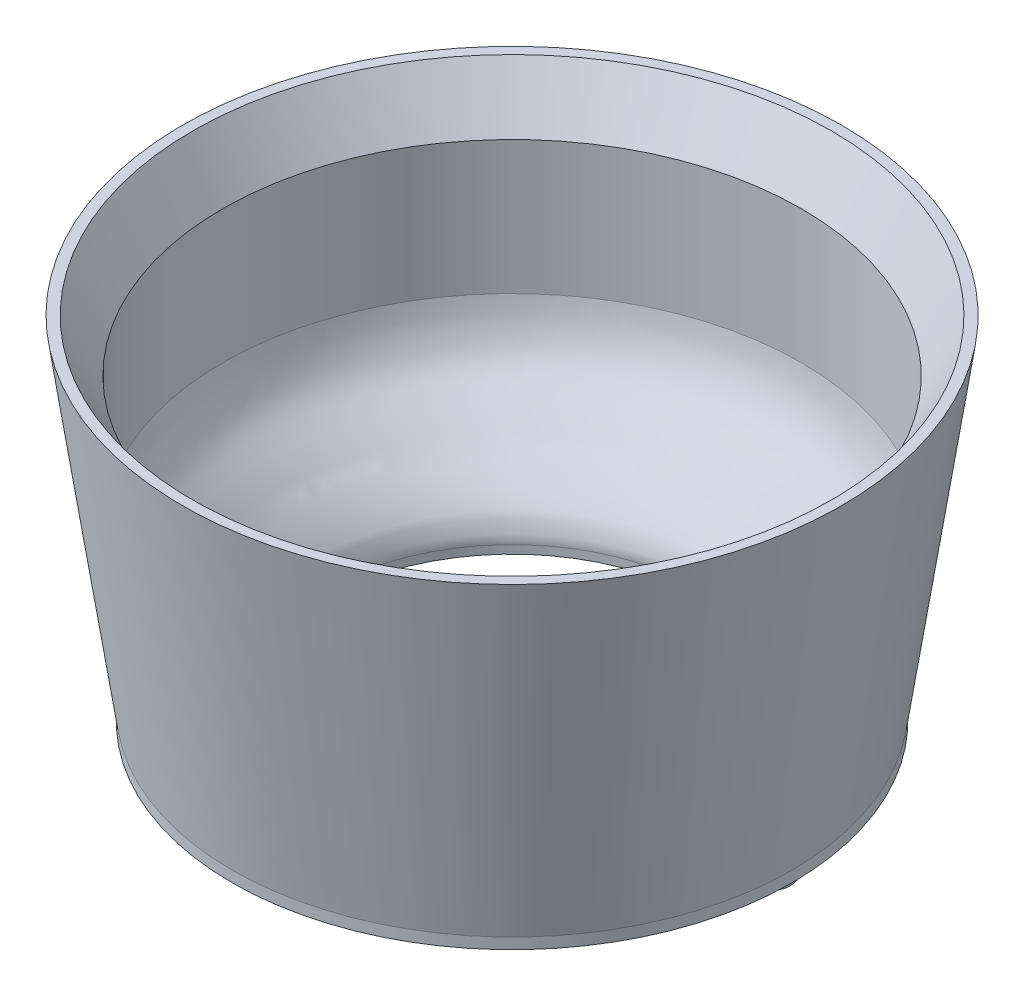
from build123d import *

# Parameters (mm, degrees)
SKETCH4_R           = 3
BOSS_EXTRUDE1_DEPTH = 2
SKETCH9_R           = 1.5
CUT_EXTRUDE1_DEPTH  = 6
SKETCH10_R          = 2
CUT_EXTRUDE2_DEPTH  = 0.5
CHAMFER3_SIZE       = 0.55


with BuildPart() as part:
    # Sketch2 → Revolve6 (revolve)
    with BuildSketch(Plane(origin=(0, 0, 0), x_dir=(0, 0, -1), z_dir=(1, 0, 0))):
        with BuildLine():
            Line((26.5077562, 274.996982717), (26.5077562, 273.848618937))
            Line((26.5077562, 273.848618937), (39.220771912, 273.848618937))
            Line((39.220771912, 273.848618937), (46.181267187, 321.561079724))
            Line((46.181267187, 321.561079724), (44.775299462, 321.561079724))
            Line((44.775299462, 321.561079724), (40.547674755, 314.238618937))
            Line((40.547674755, 314.238618937), (40.547674755, 295.540718438))
            add(Edge.make_bspline(
                [(40.547674755, 295.540718438), (40.447740466, 295.012709616), (40.292777353, 293.970757619), (39.930889755, 292.587532753), (39.516186416, 291.581451359), (39.108370782, 290.57804728), (38.439698054, 289.316986818), (37.331416086, 288.032583079), (36.368363881, 287.115418474), (35.630231264, 286.340079673), (35.016472726, 285.762737126), (34.394259795, 285.247169223), (33.635524662, 284.556557999), (32.920361334, 283.771384038), (32.129651901, 282.986073936), (31.485241784, 282.459482323), (30.914997208, 281.963476573), (30.371700346, 281.391298159), (29.782796159, 280.80462685), (29.227584581, 280.262154528), (28.724752618, 279.674853681), (28.180386253, 279.039651715), (27.651838315, 278.470209992), (27.308145935, 277.876839187), (26.995230081, 277.127164256), (26.597952618, 276.164510632), (26.464811583, 275.470548141), (26.5077562, 274.996982717)],
                knots=[0, 0, 0, 0, 0.062544048, 0.125088096, 0.156360121, 0.187632145, 0.250176193, 0.312720241, 0.375264289, 0.406536313, 0.437808337, 0.469080362, 0.500352386, 0.562896434, 0.594168458, 0.625440482, 0.656712506, 0.68798453, 0.719256554, 0.750528579, 0.781800603, 0.813072627, 0.844344651, 0.875616675, 0.906888699, 0.938160723, 1.000704771, 1.000704771, 1.000704771, 1.000704771], degree=3))
        make_face()
    revolve(axis=Axis((0, 5, 0), (0, 1, 0)))

    # Sketch4 → Boss-Extrude1 (add)
    with BuildSketch(Plane.XZ.offset(-273.848618937)):
        with Locations(Location((-31.176914536, 18, 0), (0, 0, 270))):
            Circle(SKETCH4_R)
        with Locations(Location((36, 0, 0), (0, 0, 270))):
            Circle(SKETCH4_R)
    extrude(amount=BOSS_EXTRUDE1_DEPTH)

    # Sketch7 → Revolve7 (revolve)
    with BuildSketch(Plane(origin=(0, 0, 0), x_dir=(0, 0, -1), z_dir=(1, 0, 0))):
        with BuildLine():
            Line((39.220771912, 273.848618937), (39.220771912, 272.319355593))
            ThreePointArc((39.220771912, 272.319355593), (32.873157949, 273.157923648), (26.5077562, 273.848618937))
            Line((26.5077562, 273.848618937), (26.5077562, 274.348618937))
            Line((26.5077562, 274.348618937), (39.220771912, 274.348618937))
            Line((39.220771912, 274.348618937), (39.220771912, 273.848618937))
        make_face()
    revolve(axis=Axis((0, 5, 0), (0, 1, 0)))

    # Sketch9 → Cut-Extrude1 (cut)
    with BuildSketch(Plane.XZ.offset(-271.848618937)):
        with Locations(Location((36, 0, 0), (0, 0, 270))):
            Circle(SKETCH9_R)
        with Locations(Location((-31.176914536, 18, 0), (0, 0, 270))):
            Circle(SKETCH9_R)
    extrude(amount=-CUT_EXTRUDE1_DEPTH, mode=Mode.SUBTRACT)

    # Sketch10 → Cut-Extrude2 (cut)
    with BuildSketch(Plane.XZ.offset(-271.848618937)):
        with Locations(Location((36, 0, 0), (0, 0, 270))):
            Circle(SKETCH10_R)
        with Locations(Location((-31.176914536, 18, 0), (0, 0, 270))):
            Circle(SKETCH10_R)
    extrude(amount=-CUT_EXTRUDE2_DEPTH, mode=Mode.SUBTRACT)

    # Chamfer3
    # the kernel refuses this chamfer: 0.55 mm, written as the material it takes off along each edge
    with BuildSketch(Plane(origin=(36, 271.848618937, 0), x_dir=(0, 0, -1), z_dir=(-1, 0, 0))) as chamfer3_piece_1_section:
        Polygon((2 + CHAMFER3_SIZE, 0), (2, -CHAMFER3_SIZE), (2, 0), align=None)
    chamfer3_piece_1 = revolve(axis=Axis((36, 271.848618937, 0), (0, -1, 0)), mode=Mode.PRIVATE)
    chamfer3_piece_1 = split(chamfer3_piece_1, bisect_by=Plane(origin=(36, 272.348618937, 2.298516155), z_dir=(0, -1, 0)), keep=Keep.TOP, mode=Mode.PRIVATE)
    add(chamfer3_piece_1, mode=Mode.SUBTRACT)
    with BuildSketch(Plane(origin=(-31.176914536, 271.848618937, 18), x_dir=(0, 0, -1), z_dir=(-1, 0, 0))) as chamfer3_piece_2_section:
        Polygon((2 + CHAMFER3_SIZE, 0), (2, -CHAMFER3_SIZE), (2, 0), align=None)
    chamfer3_piece_2 = revolve(axis=Axis((-31.176914536, 271.848618937, 18), (0, -1, 0)), mode=Mode.PRIVATE)
    chamfer3_piece_2 = split(chamfer3_piece_2, bisect_by=Plane(origin=(-31.176914536, 272.348618937, 20.298516155), z_dir=(0, -1, 0)), keep=Keep.TOP, mode=Mode.PRIVATE)
    add(chamfer3_piece_2, mode=Mode.SUBTRACT)


solid = part.part
